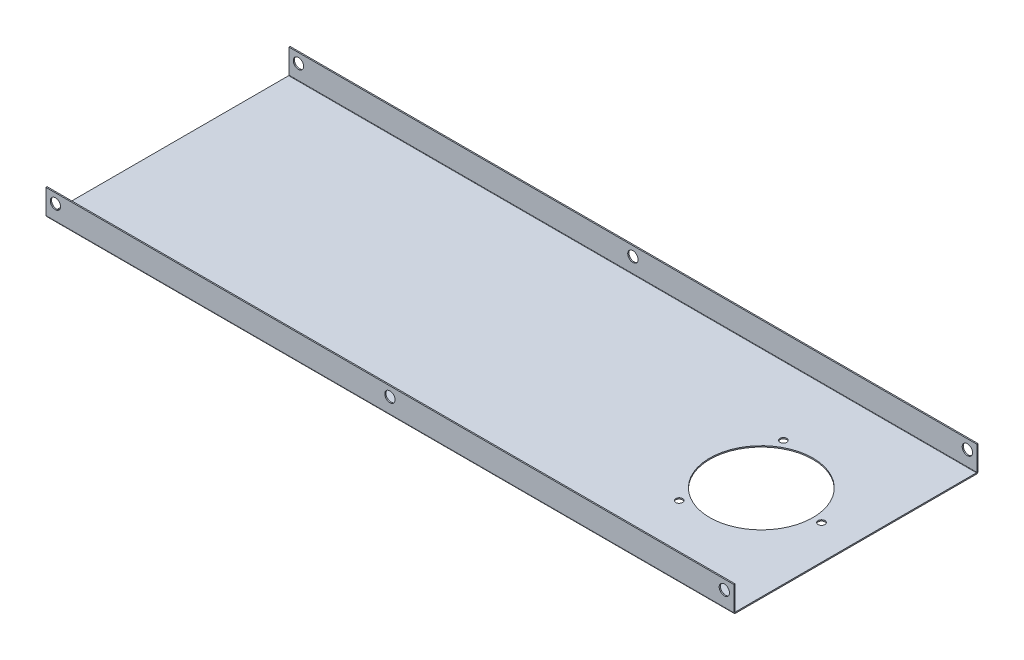
from build123d import *

# Parameters (mm, degrees)
SKETCH_1_W                         = 400
SKETCH_1_H                         = 142
SM_BASE_FLANGE_1_DEPTH             = 0.7
SM_EDGE_FLANGE_1_STRIP_W           = 3.2
SM_EDGE_FLANGE_1_STRIP_H           = 0.7
SM_EDGE_FLANGE_1_STRIP_CUT_DEPTH   = 400
SM_EDGE_FLANGE_1_STRIP_2_W         = 3.2
SM_EDGE_FLANGE_1_STRIP_2_H         = 0.7
SM_EDGE_FLANGE_1_STRIP_CUT_2_DEPTH = 400
SM_EDGE_FLANGE_1_DEPTH             = 400
SM_EDGE_FLANGE_1_BEND_DEPTH        = 400
SKETCH_17_R                        = 3
CUT_EXTRUDE_1_DEPTH                = 10
CUT_EXTRUDE_START                  = -10
SKETCH_18_R                        = 3
CUT_EXTRUDE_2_DEPTH                = 10
SKETCH_19_R                        = 30
SKETCH_19_R_2                      = 2
CUT_EXTRUDE_4_DEPTH                = 10


# Sheet-metal steps are written as plain solids
with BuildPart() as part:
    # 草图1 → 基体-法兰1 (new body)
    with BuildSketch(Plane(origin=(0, 0, 0), x_dir=(1, 0, 0), z_dir=(0, 1, 0))):
        Rectangle(SKETCH_1_W, SKETCH_1_H)
    extrude(amount=-SM_BASE_FLANGE_1_DEPTH)

    # 边线-法兰1 strip (across the edge) → 边线-法兰1 strip cut (cut)
    with BuildSketch(Plane(origin=(200, 0, -71), x_dir=(0, 0, 1), z_dir=(-1, 0, 0))):
        with Locations((-0.7, -0.35)):
            Rectangle(SM_EDGE_FLANGE_1_STRIP_W, SM_EDGE_FLANGE_1_STRIP_H)
    extrude(amount=SM_EDGE_FLANGE_1_STRIP_CUT_DEPTH, mode=Mode.SUBTRACT)

    # 边线-法兰1 strip 2 (across the edge) → 边线-法兰1 strip cut 2 (cut)
    with BuildSketch(Plane(origin=(-200, 0, 71), x_dir=(0, 0, -1), z_dir=(1, 0, 0))):
        with Locations((-0.7, -0.35)):
            Rectangle(SM_EDGE_FLANGE_1_STRIP_2_W, SM_EDGE_FLANGE_1_STRIP_2_H)
    extrude(amount=SM_EDGE_FLANGE_1_STRIP_CUT_2_DEPTH, mode=Mode.SUBTRACT)

    # 边线-法兰1 section (across the edge) → 边线-法兰1 (add)
    with BuildSketch(Plane(origin=(200, 0, -71), x_dir=(0, 0, 1), z_dir=(-1, 0, 0))):
        with BuildLine():
            Line((0, 0.2), (0, 14.3))
            Line((0, 14.3), (0.7, 14.3))
            Line((0.7, 14.3), (0.7, 0.2))
            ThreePointArc((0.7, 0.2), (0.758578644, 0.058578644), (0.9, 0))
            Line((0.9, 0), (0.9, -0.7))
            ThreePointArc((0.9, -0.7), (0.263603897, -0.436396103), (0, 0.2))
        make_face()
    extrude(amount=SM_EDGE_FLANGE_1_DEPTH)

    # 边线-法兰1 section 2 (across the edge) → 边线-法兰1 bend (add)
    with BuildSketch(Plane(origin=(-200, 0, 71), x_dir=(0, 0, -1), z_dir=(1, 0, 0))):
        with BuildLine():
            Line((0, 0.2), (0, 14.3))
            Line((0, 14.3), (0.7, 14.3))
            Line((0.7, 14.3), (0.7, 0.2))
            ThreePointArc((0.7, 0.2), (0.758578644, 0.058578644), (0.9, 0))
            Line((0.9, 0), (0.9, -0.7))
            ThreePointArc((0.9, -0.7), (0.263603897, -0.436396103), (0, 0.2))
        make_face()
    extrude(amount=SM_EDGE_FLANGE_1_BEND_DEPTH)

    # 草图17 → 切除-拉伸1 (cut)
    with BuildSketch(Plane(origin=(0, 0, -71), x_dir=(-1, 0, 0), z_dir=(0, 0, -1))):
        with Locations(Location((-194.5, 8.8, 0), (0, 0, 90))):
            Circle(SKETCH_17_R)
        with Locations(Location((0, 8.8, 0), (0, 0, 90))):
            Circle(SKETCH_17_R)
        with Locations(Location((194.5, 8.8, 0), (0, 0, 270))):
            Circle(SKETCH_17_R)
    extrude(amount=-CUT_EXTRUDE_1_DEPTH, mode=Mode.SUBTRACT)

    # 草图18 → 切除-拉伸2 (cut)
    with BuildSketch(Plane.XY.offset(71).offset(CUT_EXTRUDE_START)):
        with Locations(Location((-194.5, 8.8, 0), (0, 0, 270))):
            Circle(SKETCH_18_R)
        with Locations(Location((0, 8.8, 0), (0, 0, 90))):
            Circle(SKETCH_18_R)
        with Locations(Location((194.5, 8.8, 0), (0, 0, 90))):
            Circle(SKETCH_18_R)
    extrude(amount=CUT_EXTRUDE_2_DEPTH, mode=Mode.SUBTRACT)

    # 草图19 → 切除-拉伸4 (cut)
    with BuildSketch(Plane.XZ.offset(0.7)):
        with Locations(Location((145, 0, 0), (0, 0, 270))):
            Circle(SKETCH_19_R)
        with Locations(Location((127.5, 30.310889132, 0), (0, 0, 270))):
            Circle(SKETCH_19_R_2)
        with Locations(Location((180, 0, 0), (0, 0, 270))):
            Circle(SKETCH_19_R_2)
        with Locations(Location((127.5, -30.310889132, 0), (0, 0, 270))):
            Circle(SKETCH_19_R_2)
    extrude(amount=-CUT_EXTRUDE_4_DEPTH, mode=Mode.SUBTRACT)


solid = part.part
